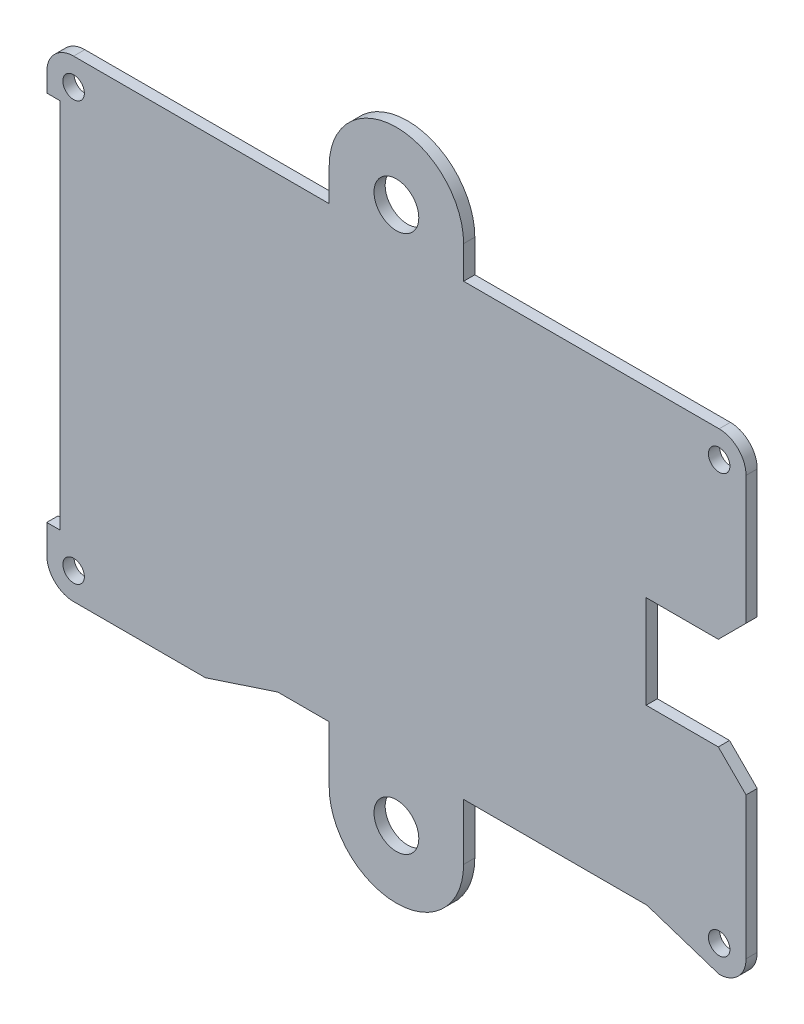
from build123d import *

# Parameters (mm, degrees)
SKETCH1_R           = 1.355900406
BOSS_EXTRUDE1_DEPTH = 1.5875
SKETCH2_R           = 3.175
BOSS_EXTRUDE2_DEPTH = 1.5875
SKETCH3_R           = 1.524
CUT_EXTRUDE1_DEPTH  = 436.184338179


with BuildPart() as part:
    # Sketch1 → Boss-Extrude1 (new body)
    with BuildSketch(Plane.XY):
        with BuildLine():
            Line((-301.9473, 111.74645), (-305.87795, 115.6771))
            Line((-305.87795, 115.6771), (-316.1078, 115.6771))
            Line((-316.1078, 115.6771), (-316.1078, 128.8851))
            Line((-316.1078, 128.8851), (-305.87795, 128.8851))
            Line((-305.87795, 128.8851), (-301.9473, 132.81575))
            Line((-301.9473, 132.81575), (-301.9473, 150.9704))
            ThreePointArc((-301.9473, 150.9704), (-303.063223164, 153.664476836), (-305.7573, 154.7804))
            Line((-305.7573, 154.7804), (-397.247125, 154.7804))
            ThreePointArc((-397.247125, 154.7804), (-399.946077222, 153.659592612), (-401.0571, 150.956597849))
            Line((-401.0571, 150.956597849), (-401.0571, 148.341))
            Line((-401.0571, 148.341), (-399.1521, 148.341))
            Line((-399.1521, 148.341), (-399.1521, 95.6449))
            Line((-399.1521, 95.6449), (-401.0571, 95.6449))
            Line((-401.0571, 95.6449), (-401.0571, 91.659304166))
            ThreePointArc((-401.0571, 91.659304166), (-399.951018769, 88.947400452), (-397.2472, 87.8217))
            Line((-397.2472, 87.8217), (-378.5565, 87.8217))
            Line((-378.5565, 87.8217), (-368.3165, 91.1883))
            Line((-368.3165, 91.1883), (-315.9973, 91.1883))
            Line((-315.9973, 91.1883), (-305.7573, 87.8217))
            ThreePointArc((-305.7573, 87.8217), (-303.063223164, 88.937623164), (-301.9473, 91.6317))
            Line((-301.9473, 91.6317), (-301.9473, 111.74645))
        make_face()
        with Locations((-305.7573, 91.6317)):
            Circle(SKETCH1_R, mode=Mode.SUBTRACT)
        with Locations((-305.7573, 150.9704)):
            Circle(SKETCH1_R, mode=Mode.SUBTRACT)
        with Locations((-397.247125, 150.9704)):
            Circle(SKETCH1_R, mode=Mode.SUBTRACT)
        with Locations((-397.2472, 91.6317)):
            Circle(SKETCH1_R, mode=Mode.SUBTRACT)
    extrude(amount=BOSS_EXTRUDE1_DEPTH)

    # Sketch2 → Boss-Extrude2 (add)
    # profile 1 of 2: a face of its own
    with BuildSketch(Plane.XY.offset(1.5875)):
        with BuildLine():
            Line((-361.0272, 159.40105), (-361.0272, 154.7804))
            Line((-361.0272, 154.7804), (-341.9772, 154.7804))
            Line((-341.9772, 154.7804), (-341.9772, 159.40105))
            ThreePointArc((-341.9772, 159.40105), (-351.5022, 168.92605), (-361.0272, 159.40105))
        make_face()
        with Locations((-351.5022, 159.40105)):
            Circle(SKETCH2_R, mode=Mode.SUBTRACT)
    # profile 2 of 2: a face of its own
    with BuildSketch(Plane.XY.offset(1.5875)):
        with BuildLine():
            Line((-341.9772, 91.1883), (-361.0272, 91.1883))
            Line((-361.0272, 91.1883), (-361.0272, 83.20105))
            ThreePointArc((-361.0272, 83.20105), (-351.5022, 73.67605), (-341.9772, 83.20105))
            Line((-341.9772, 83.20105), (-341.9772, 91.1883))
        make_face()
        with Locations((-351.5022, 83.20105)):
            Circle(SKETCH2_R, mode=Mode.SUBTRACT)
    extrude(amount=-BOSS_EXTRUDE2_DEPTH)

    # Sketch3 → Cut-Extrude1 (cut, through all)
    with BuildSketch(Plane.XY.offset(1.5875)):
        with Locations((-397.247125, 150.9704)):
            Circle(SKETCH3_R)
        with Locations((-305.7573, 150.9704)):
            Circle(SKETCH3_R)
        with Locations((-305.7573, 91.6317)):
            Circle(SKETCH3_R)
        with Locations((-397.2472, 91.6317)):
            Circle(SKETCH3_R)
    extrude(amount=-CUT_EXTRUDE1_DEPTH, mode=Mode.SUBTRACT)


solid = part.part
